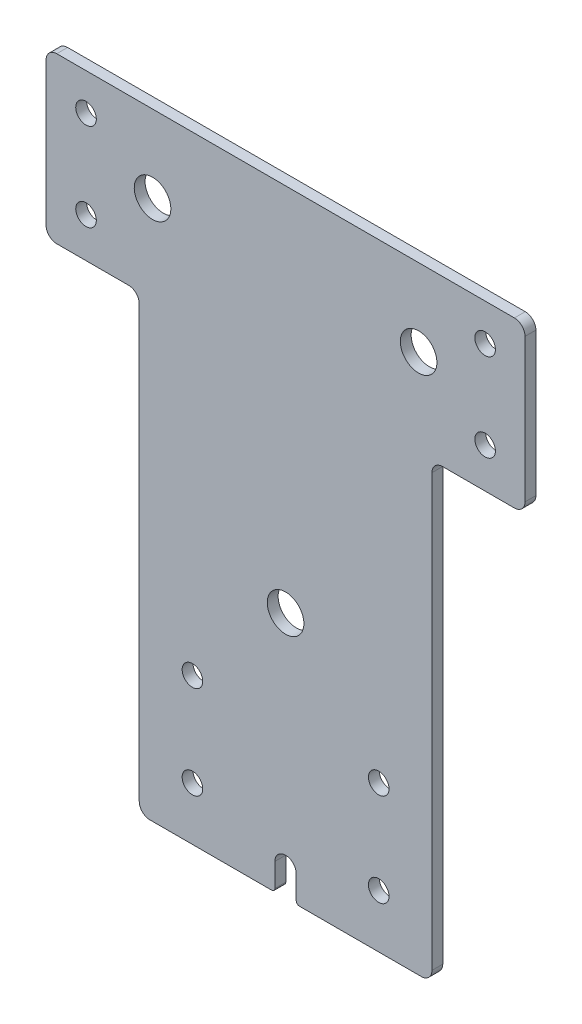
from build123d import *

# Parameters (mm, degrees)
SKETCH1_W                                 = 2.58826
SKETCH1_H                                 = 152.4
BASE_FLANGE1_DEPTH                        = 69.85
SKETCH2_W                                 = 22.225
SKETCH2_H                                 = 44.45
BOSS_EXTRUDE1_DEPTH                       = 2.58826
F_10_0_1935_DIAMETER_HOLE1_D              = 4.9149
SKETCH5_W                                 = 114.3
SKETCH5_H                                 = 5.16255
CUT_EXTRUDE1_DEPTH                        = 179.073762006
FILLET1_R                                 = 2.54
HOLE_FOR_1_4_SELF_CLINCHING_NUTS_S_SS_C_D = 8.7376
CUT_EXTRUDE2_DEPTH                        = 179.073762006
FILLET2_R                                 = 0.762


# Sheet-metal steps are written as plain solids
with BuildPart() as part:
    # Sketch1 → Base-Flange1 (new body)
    with BuildSketch(Plane(origin=(0, 0, 0), x_dir=(0, 0, -1), z_dir=(1, 0, 0))):
        with Locations((-1.29413, -76.2)):
            Rectangle(SKETCH1_W, SKETCH1_H)
    extrude(amount=BASE_FLANGE1_DEPTH)

    # Sketch2 → Boss-Extrude1 (add)
    with BuildSketch(Plane(origin=(0, 0, 0), x_dir=(-1, 0, 0), z_dir=(0, 0, -1))):
        with Locations((-80.9625, -22.225)):
            Rectangle(SKETCH2_W, SKETCH2_H)
        with Locations((11.1125, -22.225)):
            Rectangle(SKETCH2_W, SKETCH2_H)
    extrude(amount=-BOSS_EXTRUDE1_DEPTH)

    # #10 (0.1935) Diameter Hole1 (through all)
    with Locations(Plane(origin=(0, 0, 0), x_dir=(-1, 0, 0), z_dir=(0, 0, -1))):
        with Locations((-82.55, -13.97), (-82.55, -34.925), (12.7, -34.925), (12.7, -13.97), (-57.15, -117.475), (-57.15, -139.7), (-12.7, -139.7), (-12.7, -117.475)):
            Hole(F_10_0_1935_DIAMETER_HOLE1_D / 2)

    # Sketch5 → Cut-Extrude1 (cut, through all)
    with BuildSketch(Plane(origin=(0, 0, 0), x_dir=(-1, 0, 0), z_dir=(0, 0, -1))):
        with Locations((-34.925, -2.581275)):
            Rectangle(SKETCH5_W, SKETCH5_H)
    extrude(amount=-CUT_EXTRUDE1_DEPTH, mode=Mode.SUBTRACT)

    # Fillet1
    fillet1_edges = [part.edges().sort_by_distance(p)[0] for p in [
        (92.075, -44.45, 1.29413),
        (69.85, -44.45, 1.29413),
        (69.85, -152.4, 1.29413),
        (0, -44.45, 1.29413),
        (-22.225, -44.45, 1.29413),
        (0, -152.4, 1.29413),
        (92.075, -5.16255, 1.29413),
        (-22.225, -5.16255, 1.29413),
    ]]
    fillet(fillet1_edges, radius=FILLET1_R)

    # Hole for 1/4 Self-clinching Nuts (S,SS,CLS,CLSS)1 (through all)
    with Locations(Plane(origin=(0, 0, 0), x_dir=(-1, 0, 0), z_dir=(0, 0, -1))):
        with Locations((-66.675, -23.622), (-3.175, -23.622), (-34.925, -93.472)):
            Hole(HOLE_FOR_1_4_SELF_CLINCHING_NUTS_S_SS_C_D / 2)

    # Sketch8 → Cut-Extrude2 (cut, through all)
    with BuildSketch(Plane(origin=(0, 0, 0), x_dir=(-1, 0, 0), z_dir=(0, 0, -1))):
        with BuildLine():
            Line((-37.465, -152.4), (-37.465, -146.05))
            ThreePointArc((-37.465, -146.05), (-34.925, -143.51), (-32.385, -146.05))
            Line((-32.385, -146.05), (-32.385, -152.4))
            Line((-32.385, -152.4), (-37.465, -152.4))
        make_face()
    extrude(amount=-CUT_EXTRUDE2_DEPTH, mode=Mode.SUBTRACT)

    # Fillet2
    fillet2_edges = [part.edges().sort_by_distance(p)[0] for p in [
        (32.385, -152.4, 1.29413),
        (37.465, -152.4, 1.29413),
    ]]
    fillet(fillet2_edges, radius=FILLET2_R)


solid = part.part
